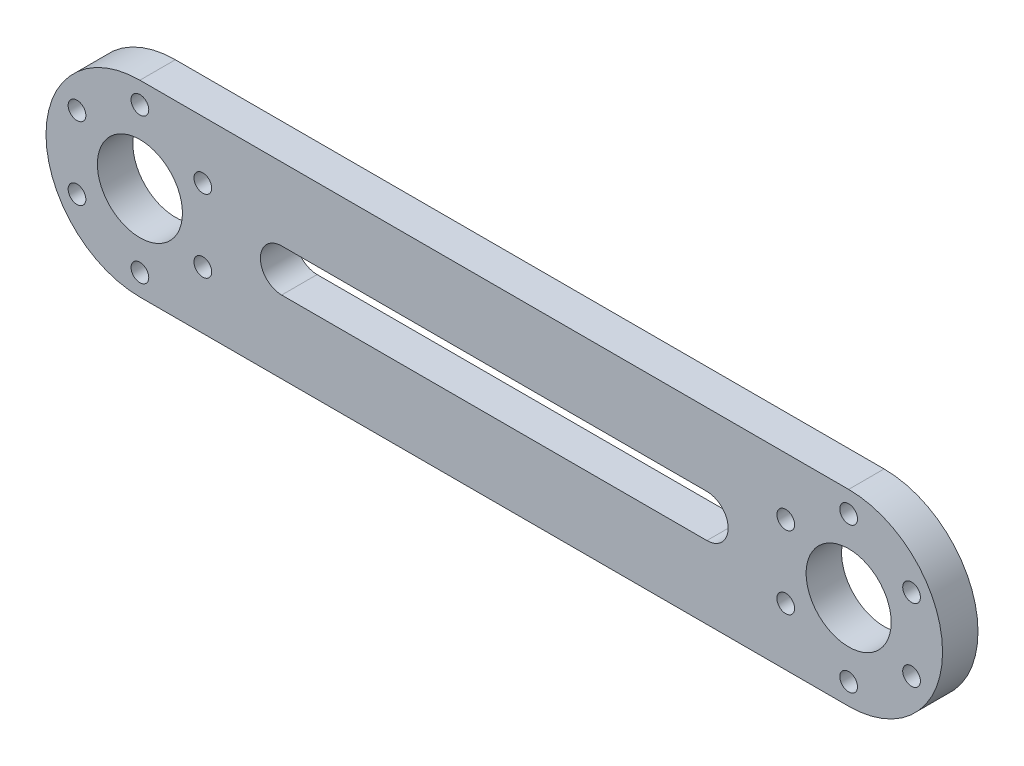
from build123d import *

# Parameters (mm, degrees)
SKETCH1_R           = 6
BOSS_EXTRUDE1_DEPTH = 5
SKETCH2_R           = 1.25
CUT_EXTRUDE1_DEPTH  = 115.132050713


with BuildPart() as part:
    # Sketch1 → Boss-Extrude1 (new body)
    with BuildSketch(Plane.XY):
        with BuildLine():
            Line((100, 13.25), (0, 13.25))
            ThreePointArc((0, 13.25), (-13.25, 0), (0, -13.25))
            Line((0, -13.25), (100, -13.25))
            ThreePointArc((100, -13.25), (113.25, 0), (100, 13.25))
        make_face()
        with BuildLine():
            Line((80, -3), (20, -3))
            ThreePointArc((20, -3), (17, 0), (20, 3))
            Line((20, 3), (80, 3))
            ThreePointArc((80, 3), (83, 0), (80, -3))
        make_face(mode=Mode.SUBTRACT)
        with Locations((100, 0)):
            Circle(SKETCH1_R, mode=Mode.SUBTRACT)
        Circle(SKETCH1_R, mode=Mode.SUBTRACT)
    extrude(amount=BOSS_EXTRUDE1_DEPTH)

    # Sketch2 → Cut-Extrude1 (cut, through all)
    with BuildSketch(Plane.XY.offset(5)):
        with Locations((8.876760389, 5.125)):
            Circle(SKETCH2_R)
        with Locations((8.876760389, -5.125)):
            Circle(SKETCH2_R)
        with Locations((-8.876760389, 5.125)):
            Circle(SKETCH2_R)
        with Locations((-8.876760389, -5.125)):
            Circle(SKETCH2_R)
        with Locations((0, 10.25)):
            Circle(SKETCH2_R)
        with Locations((0, -10.25)):
            Circle(SKETCH2_R)
        with Locations((100, -10.25)):
            Circle(SKETCH2_R)
        with Locations((108.876760389, -5.125)):
            Circle(SKETCH2_R)
        with Locations((108.876760389, 5.125)):
            Circle(SKETCH2_R)
        with Locations((100, 10.25)):
            Circle(SKETCH2_R)
        with Locations((91.123239611, 5.125)):
            Circle(SKETCH2_R)
        with Locations((91.123239611, -5.125)):
            Circle(SKETCH2_R)
    extrude(amount=-CUT_EXTRUDE1_DEPTH, mode=Mode.SUBTRACT)


solid = part.part
